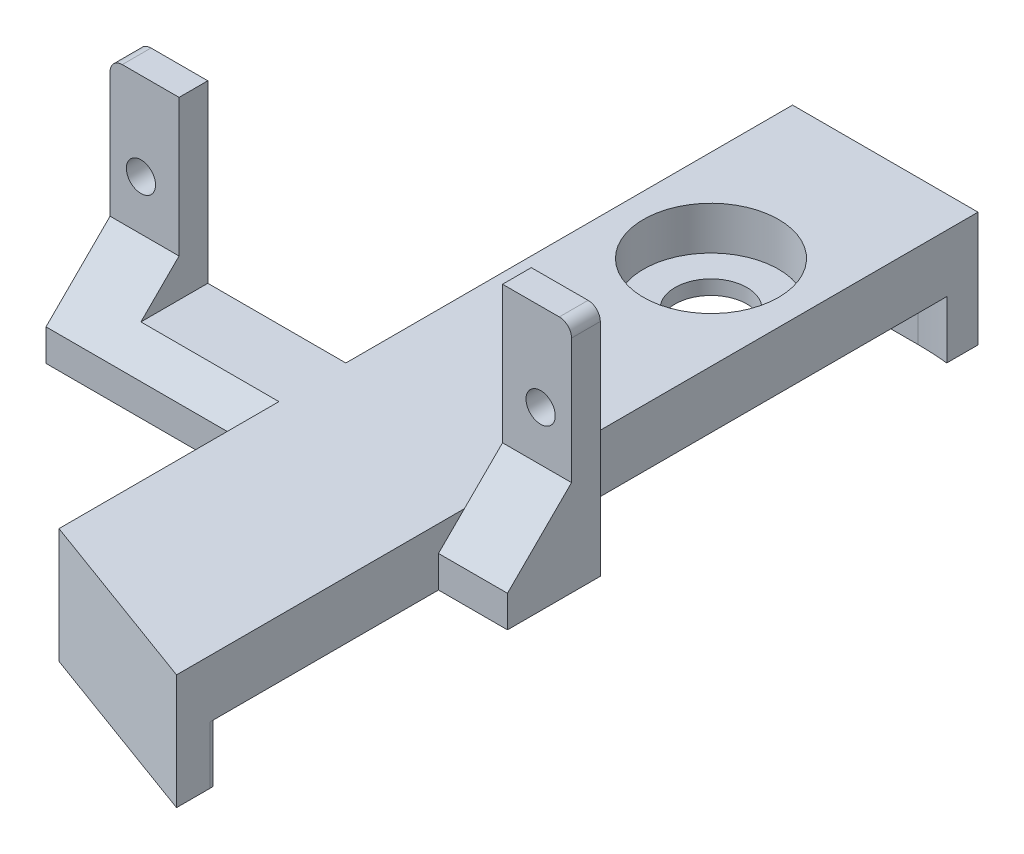
from build123d import *

# Parameters (mm, degrees)
SKETCH1_R                       = 1.016
BOSS_EXTRUDE1_DEPTH             = 2
BOSS_EXTRUDE2_OUTLINE_R         = 4.7
BOSS_EXTRUDE2_DEPTH             = 3
BOSS_EXTRUDE5_DEPTH             = 8
BOSS_EXTRUDE6_REACH             = 45.699
BOSS_EXTRUDE6_DIRECTION_2_REACH = 45.699
SKETCH4_W                       = 22.5
SKETCH4_H                       = 14.127681706
CUT_EXTRUDE1_DEPTH              = 7
FILLET1_R                       = 0.5
SKETCH5_R                       = 2.5
BOSS_EXTRUDE7_DEPTH             = 1
SKETCH6_W                       = 5.313656685
SKETCH6_H                       = 4.599259183
SKETCH6_W_2                     = 16.163165117
SKETCH6_H_2                     = 5.344557169
CUT_EXTRUDE2_DEPTH              = 5


# Read off the part's stored shape, not the designer's step: Boss-Extrude2
with BuildPart() as part:
    # Sketch1 → Boss-Extrude1 (new body)
    # profile 1 of 4: a face of its own
    with BuildSketch(Plane.XY):
        with BuildLine():
            Line((-16.05, 5.25), (-16.05, -5.25))
            ThreePointArc((-16.05, -5.25), (-15.801040764, -5.851040764), (-15.2, -6.1))
            Line((-15.2, -6.1), (-11.25, -6.1))
            Line((-11.25, -6.1), (-11.25, 6.1))
            Line((-11.25, 6.1), (-15.2, 6.1))
            ThreePointArc((-15.2, 6.1), (-15.801040764, 5.851040764), (-16.05, 5.25))
        make_face()
        with Locations((-13.9, 0)):
            Circle(SKETCH1_R, mode=Mode.SUBTRACT)
    # profile 2 of 4: a face of its own
    with BuildSketch(Plane.XY):
        with BuildLine():
            Line((16.05, 5.25), (16.05, -5.25))
            ThreePointArc((16.05, -5.25), (15.801040764, -5.851040764), (15.2, -6.1))
            Line((15.2, -6.1), (11.25, -6.1))
            Line((11.25, -6.1), (11.25, 6.094097151))
            Line((11.25, 6.094097151), (15.2, 6.1))
            ThreePointArc((15.2, 6.1), (15.801040764, 5.851040764), (16.05, 5.25))
        make_face()
        with Locations((13.9, 0)):
            Circle(SKETCH1_R, mode=Mode.SUBTRACT)
    # profile 3 of 4: a face of its own
    with BuildSketch(Plane.XY):
        with BuildLine():
            ThreePointArc((15.2, -6.1), (15.801040764, -5.851040764), (16.05, -5.25))
            Line((16.05, -5.25), (16.05, -6.1))
            Line((16.05, -6.1), (15.2, -6.1))
        make_face()
    # profile 4 of 4: a face of its own
    with BuildSketch(Plane.XY):
        with BuildLine():
            ThreePointArc((-16.05, -5.25), (-15.801040764, -5.851040764), (-15.2, -6.1))
            Line((-15.2, -6.1), (-16.05, -6.1))
            Line((-16.05, -6.1), (-16.05, -5.25))
        make_face()
    extrude(amount=BOSS_EXTRUDE1_DEPTH)

    # Boss-Extrude2 outline → Boss-Extrude2 (add)
    with BuildSketch(Plane.XZ.offset(6.1)):
        Polygon((-16.05, 2), (-16.05, 0), (-1.65, 0), (-1.65, -31.072136217), (11.25, -31.072136217), (11.25, 0), (16.05, 0), (16.05, 2), (11.25, 2), (11.25, 24.675592953), (-1.65, 19.952742461), (-1.65, 2), align=None)
        with Locations((4.75, -19)):
            Circle(BOSS_EXTRUDE2_OUTLINE_R, mode=Mode.SUBTRACT)
    extrude(amount=BOSS_EXTRUDE2_DEPTH)

    # Sketch2<3> → Boss-Extrude5 (add)
    with BuildSketch(Plane.XZ.offset(6.1)):
        with BuildLine():
            Line((-1.65, 19.952742461), (-1.65, 16.386819499))
            ThreePointArc((-1.65, 16.386819499), (-0.390222028, 17.279485189), (0.991848608, 17.967797132))
            Line((0.991848608, 17.967797132), (11.246245603, 22.12156627))
            Line((11.246245603, 22.12156627), (11.25, 22.341096015))
            Line((11.25, 22.341096015), (11.25, 24.675592953))
            Line((11.25, 24.675592953), (-1.65, 19.952742461))
        make_face()
        with BuildLine():
            ThreePointArc((4.75, -29.01), (1.347387634, -28.413943333), (-1.65, -26.696759058))
            Line((-1.65, -26.696759058), (-1.65, -31.072136217))
            Line((-1.65, -31.072136217), (11.25, -31.072136217))
            Line((11.25, -31.072136217), (11.25, -28.899497484))
            ThreePointArc((11.25, -28.899497484), (10.201440757, -28.982355275), (9.149976222, -29.01))
            Line((9.149976222, -29.01), (4.75, -29.01))
        make_face()
    extrude(amount=BOSS_EXTRUDE5_DEPTH)

    # Boss-Extrude6: up to this face of the body (flat: up to its plane)
    boss_extrude6_end = Plane(part.part.faces().sort_by_distance((16.05, -1.925, 1))[0])
    # Sketch3 → Boss-Extrude6 (add, up to the picked face)
    with BuildSketch(Plane(origin=(11.25, 0, 0), x_dir=(0, 0, -1), z_dir=(1, 0, 0)), mode=Mode.PRIVATE) as boss_extrude6_sk1:
        Polygon((-7.665828596, -9.1), (-2, -3.457464127), (-2, -9.1), align=None)
    boss_extrude6_tool1 = split(extrude(boss_extrude6_sk1.sketch, amount=BOSS_EXTRUDE6_REACH, mode=Mode.PRIVATE), bisect_by=boss_extrude6_end, keep=Keep.BOTH, mode=Mode.PRIVATE)
    add(boss_extrude6_tool1.solids().sort_by(Axis((11.25, -7.219155, 3.88861), (1, 0, 0)))[0])

    # Boss-Extrude6 direction 2: up to this face of the body (flat: up to its plane)
    boss_extrude6_direction_2_end = Plane(part.part.faces().sort_by_distance((-16.05, -1.925, 1))[0])
    # Sketch3 → Boss-Extrude6 direction 2 (add, up to the picked face)
    with BuildSketch(Plane(origin=(11.25, 0, 0), x_dir=(0, 0, -1), z_dir=(1, 0, 0)), mode=Mode.PRIVATE) as boss_extrude6_direction_2_sk1:
        Polygon((-7.665828596, -9.1), (-2, -3.457464127), (-2, -9.1), align=None)
    boss_extrude6_direction_2_tool1 = split(extrude(boss_extrude6_direction_2_sk1.sketch, amount=-BOSS_EXTRUDE6_DIRECTION_2_REACH, mode=Mode.PRIVATE), bisect_by=boss_extrude6_direction_2_end, keep=Keep.BOTH, mode=Mode.PRIVATE)
    add(boss_extrude6_direction_2_tool1.solids().sort_by(Axis((11.25, -7.219155, 3.88861), (-1, 0, 0)))[0])

    # Sketch4 → Cut-Extrude1 (cut)
    with BuildSketch(Plane(origin=(0, -6.1, 0), x_dir=(1, 0, 0), z_dir=(0, 1, 0))):
        with Locations((0, -7.063840853)):
            Rectangle(SKETCH4_W, SKETCH4_H)
    extrude(amount=CUT_EXTRUDE1_DEPTH, mode=Mode.SUBTRACT)

    # Fillet1
    fillet1_edges = [part.edges().sort_by_distance(p)[0] for p in [
        (13.65, -9.1, 7.665828596),
        (-8.85, -9.1, 7.665828596),
    ]]
    fillet(fillet1_edges, radius=FILLET1_R)

    # Sketch5 → Boss-Extrude7 (add)
    with BuildSketch(Plane.XZ.offset(9.1)):
        with BuildLine():
            Line((-1.65, 16.386819499), (-1.65, 6.455196792))
            Line((-1.65, 6.455196792), (-16.05, 6.455196792))
            Line((-16.05, 6.455196792), (-16.05, 0))
            Line((-16.05, 0), (-1.65, 0))
            Line((-1.65, 0), (-1.65, -26.696759058))
            ThreePointArc((-1.65, -26.696759058), (1.347387634, -28.413943333), (4.75, -29.01))
            Line((4.75, -29.01), (9.149976222, -29.01))
            ThreePointArc((9.149976222, -29.01), (10.201440757, -28.982355275), (11.25, -28.899497484))
            Line((11.25, -28.899497484), (11.25, 0))
            Line((11.25, 0), (16.05, 0))
            Line((16.05, 0), (16.05, 6.455196792))
            Line((16.05, 6.455196792), (11.25, 6.455196792))
            Line((11.25, 6.455196792), (11.25, 22.341096015))
            Line((11.25, 22.341096015), (11.246245603, 22.12156627))
            Line((11.246245603, 22.12156627), (0.991848608, 17.967797132))
            ThreePointArc((0.991848608, 17.967797132), (-0.390222028, 17.279485189), (-1.65, 16.386819499))
        make_face()
        with Locations((4.75, -19)):
            Circle(SKETCH5_R, mode=Mode.SUBTRACT)
    extrude(amount=BOSS_EXTRUDE7_DEPTH)

    # Sketch6 → Cut-Extrude2 (cut)
    with BuildSketch(Plane.XY.offset(6.455196792)):
        with Locations((13.906828343, -7.800370409)):
            Rectangle(SKETCH6_W, SKETCH6_H)
        with Locations((-9.731582558, -7.427721416)):
            Rectangle(SKETCH6_W_2, SKETCH6_H_2)
    extrude(amount=CUT_EXTRUDE2_DEPTH, mode=Mode.SUBTRACT)


solid = part.part
